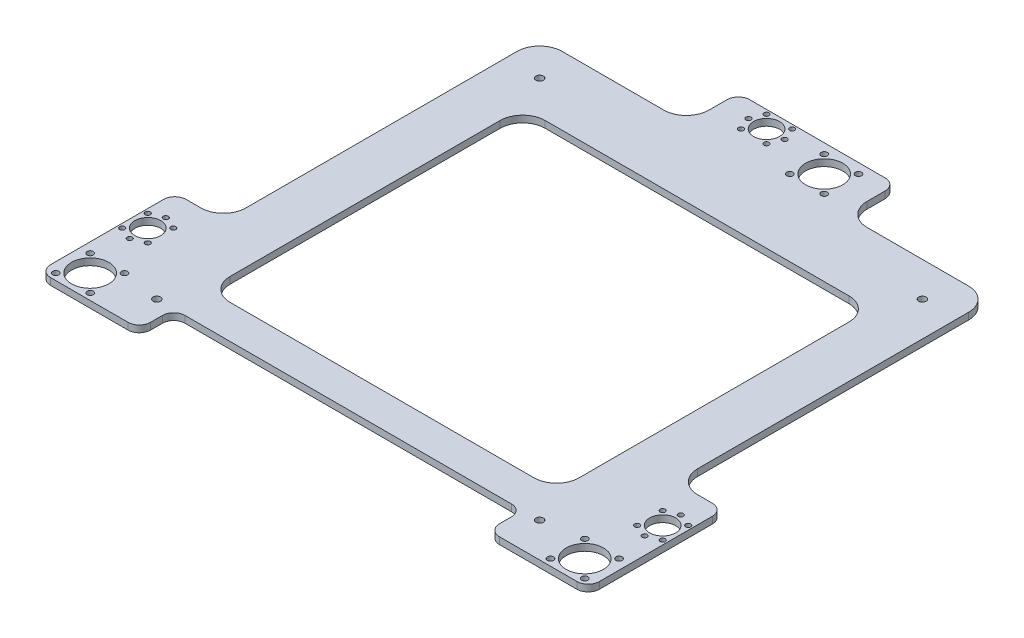
from build123d import *

# Parameters (mm, degrees)
SKETCH2_W            = 486
SKETCH2_H            = 446
BOSS_EXTRUDE1_DEPTH  = 6
M5_CLEARANCE_HOLE1_D = 5.5
M4_CLEARANCE_HOLE1_D = 4.5
SKETCH8_R            = 11.5
SKETCH8_R_2          = 16.5
CUT_EXTRUDE1_DEPTH   = 346.8337751
M5_CLEARANCE_HOLE2_D = 5.5
M4_CLEARANCE_HOLE2_D = 4.5
SKETCH13_R           = 11.5
SKETCH13_R_2         = 16.5
CUT_EXTRUDE2_DEPTH   = 346.8337751
M6_CLEARANCE_HOLE1_D = 6.6
SKETCH17_W           = 309
SKETCH17_H           = 279
CUT_EXTRUDE3_DEPTH   = 346.8337751
SKETCH18_W           = 309
SKETCH18_H           = 30.5
CUT_EXTRUDE4_DEPTH   = 346.8337751
CUT_EXTRUDE5_DEPTH   = 346.8337751
FILLET1_R            = 10
FILLET2_R            = 20


with BuildPart() as part:
    # Sketch2 → Boss-Extrude1 (new body)
    with BuildSketch(Plane(origin=(0, 0, 0), x_dir=(1, 0, 0), z_dir=(0, 1, 0))):
        with Locations((0, 23)):
            Rectangle(SKETCH2_W, SKETCH2_H)
    extrude(amount=BOSS_EXTRUDE1_DEPTH)

    # M5 Clearance Hole1 (through all)
    with Locations(Plane(origin=(0, 6, 0), x_dir=(1, 0, 0), z_dir=(0, 1, 0))):
        with Locations((-234.202795796, -163.797204204), (-203.797204204, -163.797204204), (-203.797204204, -194.202795796), (-234.202795796, -194.202795796)):
            m5_clearance_hole1 = Hole(M5_CLEARANCE_HOLE1_D / 2)

    # M4 Clearance Hole1 (through all)
    with Locations(Plane(origin=(0, 6, 0), x_dir=(1, 0, 0), z_dir=(0, 1, 0))):
        with Locations((-228, -135), (-216.686291501, -130.313708499), (-216.686291501, -107.686291501), (-228, -103), (-239.313708499, -107.686291501), (-239.313708499, -130.313708499)):
            m4_clearance_hole1 = Hole(M4_CLEARANCE_HOLE1_D / 2)

    # Sketch8 → Cut-Extrude1 (cut, through all)
    with BuildSketch(Plane(origin=(0, 6, 0), x_dir=(1, 0, 0), z_dir=(0, 1, 0))):
        with Locations((-228, -119)):
            Circle(SKETCH8_R)
        with Locations((-219, -179)):
            Circle(SKETCH8_R_2)
    cut_extrude1 = extrude(amount=-CUT_EXTRUDE1_DEPTH, mode=Mode.SUBTRACT)

    # Mirror1: M5 Clearance Hole1, M4 Clearance Hole1, Cut-Extrude1 across plane
    add(m5_clearance_hole1.mirror(Plane(origin=(0, 0, 0), x_dir=(0, 0, 1), z_dir=(1, 0, 0))), mode=Mode.SUBTRACT)
    add(m4_clearance_hole1.mirror(Plane(origin=(0, 0, 0), x_dir=(0, 0, 1), z_dir=(1, 0, 0))), mode=Mode.SUBTRACT)
    add(cut_extrude1.mirror(Plane(origin=(0, 0, 0), x_dir=(0, 0, 1), z_dir=(1, 0, 0))), mode=Mode.SUBTRACT)

    # M5 Clearance Hole2 (through all)
    with Locations(Plane(origin=(0, 6, 0), x_dir=(1, 0, 0), z_dir=(0, 1, 0))):
        with Locations((45.202795796, 206.797204204), (14.797204204, 206.797204204), (14.797204204, 237.202795796), (45.202795796, 237.202795796)):
            Hole(M5_CLEARANCE_HOLE2_D / 2)

    # M4 Clearance Hole2 (through all)
    with Locations(Plane(origin=(0, 6, 0), x_dir=(1, 0, 0), z_dir=(0, 1, 0))):
        with Locations((-41.313708499, 219.686291501), (-46, 231), (-41.313708499, 242.313708499), (-18.686291501, 242.313708499), (-14, 231), (-18.686291501, 219.686291501)):
            Hole(M4_CLEARANCE_HOLE2_D / 2)

    # Sketch13 → Cut-Extrude2 (cut, through all)
    with BuildSketch(Plane(origin=(0, 6, 0), x_dir=(1, 0, 0), z_dir=(0, 1, 0))):
        with Locations((-30, 231)):
            Circle(SKETCH13_R)
        with Locations((30, 222)):
            Circle(SKETCH13_R_2)
    extrude(amount=-CUT_EXTRUDE2_DEPTH, mode=Mode.SUBTRACT)

    # M6 Clearance Hole1 (through all)
    with Locations(Plane(origin=(0, 6, 0), x_dir=(1, 0, 0), z_dir=(0, 1, 0))):
        with Locations((-169.5, -169.5), (-169.5, 169.5), (169.5, 169.5), (169.5, -169.5)):
            Hole(M6_CLEARANCE_HOLE1_D / 2)

    # Sketch17 → Cut-Extrude3 (cut, through all)
    with BuildSketch(Plane(origin=(0, 6, 0), x_dir=(1, 0, 0), z_dir=(0, 1, 0))):
        Rectangle(SKETCH17_W, SKETCH17_H)
    extrude(amount=-CUT_EXTRUDE3_DEPTH, mode=Mode.SUBTRACT)

    # Sketch18 → Cut-Extrude4 (cut, through all)
    with BuildSketch(Plane(origin=(0, 6, 0), x_dir=(1, 0, 0), z_dir=(0, 1, 0))):
        with Locations((0, -184.75)):
            Rectangle(SKETCH18_W, SKETCH18_H)
    extrude(amount=-CUT_EXTRUDE4_DEPTH, mode=Mode.SUBTRACT)

    # Sketch19 → Cut-Extrude5 (cut, through all)
    with BuildSketch(Plane(origin=(0, 6, 0), x_dir=(1, 0, 0), z_dir=(0, 1, 0))):
        Polygon((-243, -80), (-200, -80), (-200, 200), (-70, 200), (-70, 246), (-243, 246), align=None)
    cut_extrude5 = extrude(amount=-CUT_EXTRUDE5_DEPTH, mode=Mode.SUBTRACT)

    # Mirror2: Cut-Extrude5 across plane
    add(cut_extrude5.mirror(Plane(origin=(0, 0, 0), x_dir=(0, 0, 1), z_dir=(1, 0, 0))), mode=Mode.SUBTRACT)

    # Fillet1
    fillet1_edges = [part.edges().sort_by_distance(p)[0] for p in [
        (-70, 3, -246),
        (70, 3, -246),
        (243, 3, 80),
        (243, 3, 200),
        (-243, 3, 80),
        (-243, 3, 200),
        (-154.5, 3, 200),
        (-154.5, 3, 169.5),
        (154.5, 3, 200),
        (154.5, 3, 169.5),
    ]]
    fillet(fillet1_edges, radius=FILLET1_R)

    # Fillet2
    fillet2_edges = [part.edges().sort_by_distance(p)[0] for p in [
        (200, 3, -200),
        (-200, 3, -200),
        (-154.5, 3, 139.5),
        (154.5, 3, 139.5),
        (154.5, 3, -139.5),
        (-154.5, 3, -139.5),
        (-200, 3, 80),
        (-70, 3, -200),
        (70, 3, -200),
        (200, 3, 80),
    ]]
    fillet(fillet2_edges, radius=FILLET2_R)


solid = part.part
